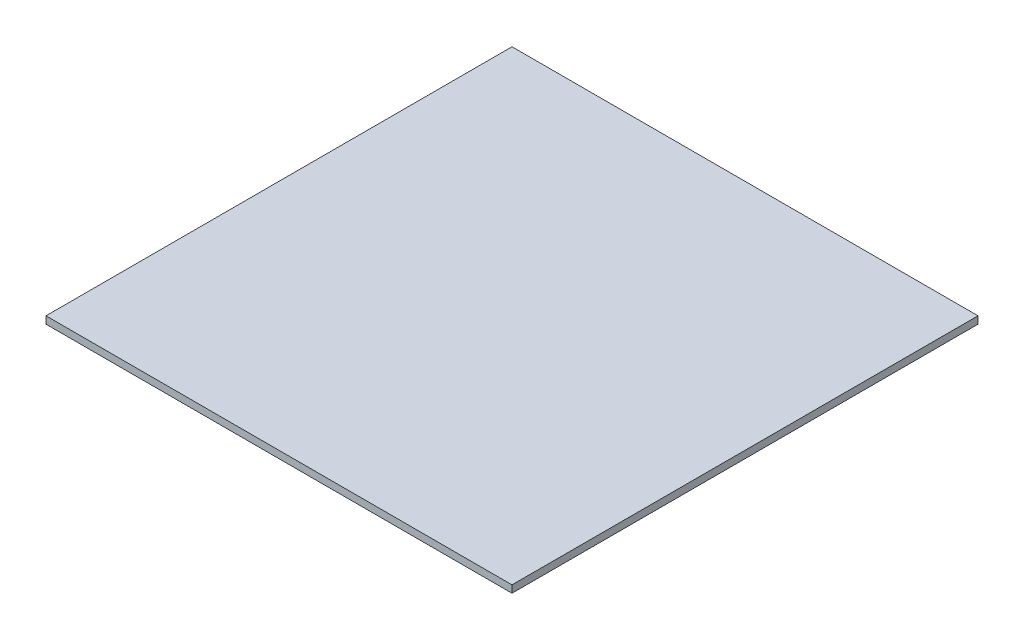
from build123d import *

# Parameters (mm, degrees)
SKETCH1_W           = 1219.2
SKETCH1_H           = 1219.2
BOSS_EXTRUDE1_DEPTH = 19.05


with BuildPart() as part:
    # Sketch1 → Boss-Extrude1 (new body)
    with BuildSketch(Plane(origin=(0, 0, 0), x_dir=(1, 0, 0), z_dir=(0, 1, 0))):
        Rectangle(SKETCH1_W, SKETCH1_H)
    extrude(amount=BOSS_EXTRUDE1_DEPTH)


solid = part.part
